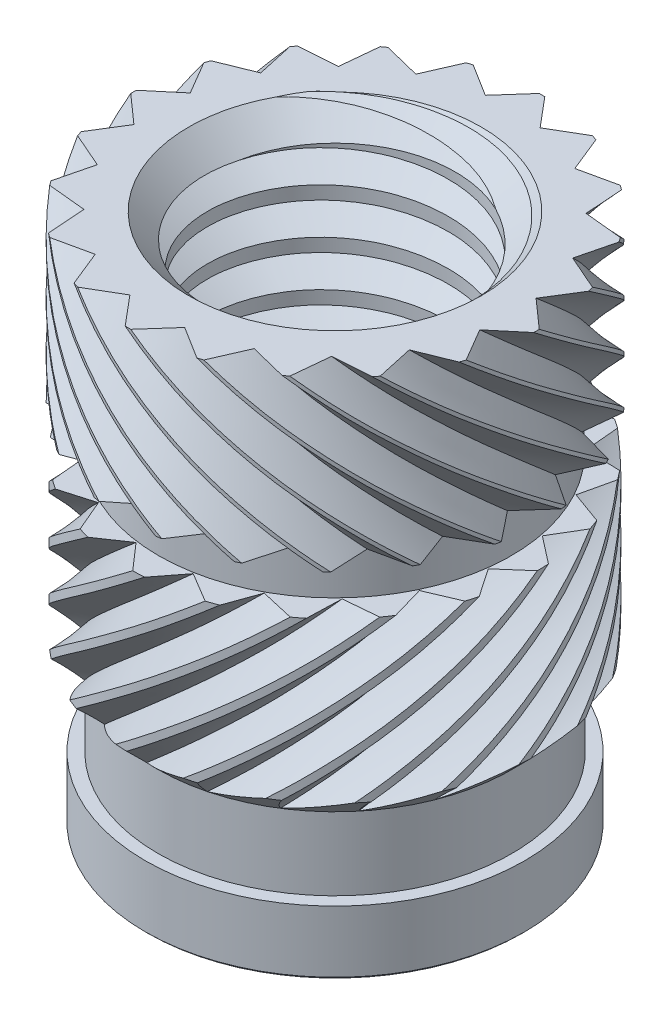
from build123d import *

# Parameters (mm, degrees)
CHAMFER2_SIZE     = 0.4
CUT_SWEEP2_PITCH  = 0.7
CUT_SWEEP7_PITCH  = 15
CIRPATTERN1_COUNT = 20
CUT_SWEEP9_PITCH  = 15
CIRPATTERN4_COUNT = 20


with BuildPart() as part:
    # Sketch1 → Revolve1 (revolve)
    with BuildSketch(Plane.XY, mode=Mode.PRIVATE) as revolve1_sk:
        Polygon((3.15, 0), (1.8553, 0), (1.8553, -8.2), (2.88478468, -8.2), (2.923211, -8.16157368), (2.923211, -7.21157368), (2.729, -7.21157368), (2.729, -6.08947368), (3.119, -5.69947368), (3.119, -3.23947368), (2.719, -3.23947368), (2.719, -2.58947368), (3.15, -2.58947368), align=None)
    revolve(revolve1_sk.sketch.rotate(Axis((0, 2.596055606, 0), (0, -1, 0)), 90), axis=Axis((0, 2.596055606, 0), (0, -1, 0)))

    # Chamfer2
    chamfer2_edges = [part.edges().sort_by_distance(p)[0] for p in [
        (0, 0, -1.8553),
    ]]
    chamfer(chamfer2_edges, length=CHAMFER2_SIZE)

    # Cut-Sweep2: the profile of Sketch3 profile screwed along a right-hand helix of 13 turns, 6 arcs to a turn; built about Z, then put on its axis
    cut_sweep2_z = Axis((0, 0, 0), (0, 0, 1))
    cut_sweep2_corners = [(1.855, 0, 0.000173205), (2.2847, 0, -0.247914206), (1.855, 0, -0.496001616)]
    with BuildLine(mode=Mode.PRIVATE) as cut_sweep2_profile:
        Line(cut_sweep2_corners[0], cut_sweep2_corners[1])
        Line(cut_sweep2_corners[1], cut_sweep2_corners[2])
        Line(cut_sweep2_corners[2], cut_sweep2_corners[0])
    cut_sweep2_cap = Face(cut_sweep2_profile.wire())
    cut_sweep2_turn_angles = [0, 30, 60, 90, 120, 150, 180, 210, 240, 270, 300, 330, 360]
    cut_sweep2_turn_weights = [1, 0.8660254037844387, 1, 0.8660254037844387, 1, 0.8660254037844387, 1, 0.8660254037844387, 1, 0.8660254037844387, 1, 0.8660254037844387, 1]
    cut_sweep2_turn_rails = [Edge.make_bspline([Vector(p[0], p[1], 0).rotate(cut_sweep2_z, cut_sweep2_turn_angles[k]) / cut_sweep2_turn_weights[k] + Vector(0, 0, p[2] + CUT_SWEEP2_PITCH * cut_sweep2_turn_angles[k] / 360) for k in range(13)], [0, 0, 0, 1, 1, 2, 2, 3, 3, 4, 4, 5, 5, 6, 6, 6], 2, cut_sweep2_turn_weights) for p in cut_sweep2_corners]
    cut_sweep2_turn_sides = [Face.make_surface_from_curves(cut_sweep2_turn_rails[p[0]], cut_sweep2_turn_rails[p[1]]) for p in [(0, 1), (1, 2), (2, 0)]]
    cut_sweep2 = Plane(origin=(0, 0, 0), x_dir=(0, 0, 1), z_dir=(0, -1, 0)) * Solid(Shell([*[p.moved(Location((0, 0, CUT_SWEEP2_PITCH * i))) for i in range(13) for p in cut_sweep2_turn_sides], cut_sweep2_cap, cut_sweep2_cap.rotate(cut_sweep2_z, 4680).moved(Location((0, 0, CUT_SWEEP2_PITCH * 4680 / 360)))]))
    add(cut_sweep2, mode=Mode.SUBTRACT)

    # Cut-Sweep7: the profile of Sketch5 screwed along a left-hand helix of 0.18 turns, 18 arcs to a turn; built about Z, then put on its axis
    cut_sweep7_z = Axis((0, 0, 0), (0, 0, 1))
    cut_sweep7_corners = [(3.15, 0, 0), (2.709611825, -0.391098779, 0), (3.021428571, -0.890768987, 0), (3.292552995, -0.47523909, 0)]
    with BuildLine(mode=Mode.PRIVATE) as cut_sweep7_profile:
        Line(cut_sweep7_corners[0], cut_sweep7_corners[1])
        Line(cut_sweep7_corners[1], cut_sweep7_corners[2])
        ThreePointArc((3.021428571, -0.890768987, 0), (3.202880723, -0.712946248, 0), (3.292552995, -0.47523909, 0))
        ThreePointArc((3.292552995, -0.47523909, 0), (3.273760551, -0.221876397, 0), (3.15, 0, 0))
    cut_sweep7_cap = Face(cut_sweep7_profile.wire())
    cut_sweep7_arcs = [((3.021428571, -0.890768987, 0), (3.253477829, -0.745959784, 0), (3.292552995, -0.47523909, 0), (1, 0.9069677000385052, 1)), ((3.292552995, -0.47523909, 0), (3.331628161, -0.204518395, 0), (3.15, 0, 0), (1, 0.9069677000385052, 1))]  # start, shoulder, end, weights
    cut_sweep7_turn_angles = [0, -10, -20, -30, -40, -50, -60, -62.4, -64.8]
    cut_sweep7_turn_weights = [1, 0.984807753012208, 1, 0.984807753012208, 1, 0.984807753012208, 1, 0.9991228300988583, 1]
    cut_sweep7_turn_rails = [Edge.make_bspline([Vector(p[0], p[1], 0).rotate(cut_sweep7_z, cut_sweep7_turn_angles[k]) / cut_sweep7_turn_weights[k] + Vector(0, 0, p[2] + -CUT_SWEEP7_PITCH * cut_sweep7_turn_angles[k] / 360) for k in range(9)], [0, 0, 0, 1, 1, 2, 2, 3, 3, 4, 4, 4], 2, cut_sweep7_turn_weights) for p in cut_sweep7_corners]
    cut_sweep7_turn_sides = [*[Face.make_surface_from_curves(cut_sweep7_turn_rails[p[0]], cut_sweep7_turn_rails[p[1]]) for p in [(0, 1), (1, 2)]], *[Face.make_bezier_surface([[Vector(p[j][0], p[j][1], 0).rotate(cut_sweep7_z, cut_sweep7_turn_angles[2 * i + k]) / cut_sweep7_turn_weights[2 * i + k] + Vector(0, 0, p[j][2] + -CUT_SWEEP7_PITCH * cut_sweep7_turn_angles[2 * i + k] / 360) for k in range(3)] for j in range(3)], [[p[3][j] * cut_sweep7_turn_weights[2 * i + k] for k in range(3)] for j in range(3)]) for p in cut_sweep7_arcs for i in range(4)]]
    cut_sweep7 = Plane(origin=(0, 0, 0), x_dir=(0, 0, 1), z_dir=(0, -1, 0)) * Solid(Shell([*cut_sweep7_turn_sides, cut_sweep7_cap, cut_sweep7_cap.rotate(cut_sweep7_z, -64.8).moved(Location((0, 0, -CUT_SWEEP7_PITCH * -64.8 / 360)))]))
    add(cut_sweep7, mode=Mode.SUBTRACT)

    # CirPattern1: Cut-Sweep7 ×20 about axis
    cirpattern1_axis = Axis((0, 1.831049977, 0), (0, -1, 0))
    for i in range(1, CIRPATTERN1_COUNT):
        add(cut_sweep7.rotate(cirpattern1_axis, i * 360 / CIRPATTERN1_COUNT), mode=Mode.SUBTRACT)

    # Cut-Sweep9: the profile of Sketch8 screwed along a right-hand helix of 0.195 turns, 18 arcs to a turn; built about Z, then put on its axis
    cut_sweep9_z = Axis((0, 0, 0), (0, 0, 1))
    cut_sweep9_corners = [(2.716374539, 0.351326576, 0), (3.119, 0, 0), (3.459874357, 0.237912417, 0), (3.406554635, 0.650167984, 0), (3.016367877, 0.793527461, 0)]
    with BuildLine(mode=Mode.PRIVATE) as cut_sweep9_profile:
        Line(cut_sweep9_corners[0], cut_sweep9_corners[1])
        Line(cut_sweep9_corners[4], cut_sweep9_corners[0])
        ThreePointArc((3.119, 0, 0), (3.322681969, 0.071323989, 0), (3.459874357, 0.237912417, 0))
        ThreePointArc((3.459874357, 0.237912417, 0), (3.490821198, 0.451490854, 0), (3.406554635, 0.650167984, 0))
        ThreePointArc((3.406554635, 0.650167984, 0), (3.231493652, 0.77637063, 0), (3.016367877, 0.793527461, 0))
    cut_sweep9_cap = Face(cut_sweep9_profile.wire())
    cut_sweep9_arcs = [((3.119, 0, 0), (3.361559821, 0.015620873, 0), (3.459874357, 0.237912417, 0), (1, 0.8551086961381499, 1)), ((3.459874357, 0.237912417, 0), (3.558188894, 0.460203961, 0), (3.406554635, 0.650167984, 0), (1, 0.8551086961381499, 1)), ((3.406554635, 0.650167984, 0), (3.254920376, 0.840132007, 0), (3.016367877, 0.793527461, 0), (1, 0.8551086961381499, 1))]  # start, shoulder, end, weights
    cut_sweep9_turn_angles = [0, 10, 20, 30, 40, 50, 60, 65.1, 70.2]
    cut_sweep9_turn_weights = [1, 0.984807753012208, 1, 0.984807753012208, 1, 0.984807753012208, 1, 0.9960410654107694, 1]
    cut_sweep9_turn_rails = [Edge.make_bspline([Vector(p[0], p[1], 0).rotate(cut_sweep9_z, cut_sweep9_turn_angles[k]) / cut_sweep9_turn_weights[k] + Vector(0, 0, p[2] + CUT_SWEEP9_PITCH * cut_sweep9_turn_angles[k] / 360) for k in range(9)], [0, 0, 0, 1, 1, 2, 2, 3, 3, 4, 4, 4], 2, cut_sweep9_turn_weights) for p in cut_sweep9_corners]
    cut_sweep9_turn_sides = [*[Face.make_surface_from_curves(cut_sweep9_turn_rails[p[0]], cut_sweep9_turn_rails[p[1]]) for p in [(0, 1), (4, 0)]], *[Face.make_bezier_surface([[Vector(p[j][0], p[j][1], 0).rotate(cut_sweep9_z, cut_sweep9_turn_angles[2 * i + k]) / cut_sweep9_turn_weights[2 * i + k] + Vector(0, 0, p[j][2] + CUT_SWEEP9_PITCH * cut_sweep9_turn_angles[2 * i + k] / 360) for k in range(3)] for j in range(3)], [[p[3][j] * cut_sweep9_turn_weights[2 * i + k] for k in range(3)] for j in range(3)]) for p in cut_sweep9_arcs for i in range(4)]]
    cut_sweep9 = Plane(origin=(0, -3.23947368, 0), x_dir=(0, 0, 1), z_dir=(0, -1, 0)) * Solid(Shell([*cut_sweep9_turn_sides, cut_sweep9_cap, cut_sweep9_cap.rotate(cut_sweep9_z, 70.2).moved(Location((0, 0, CUT_SWEEP9_PITCH * 70.2 / 360)))]))
    add(cut_sweep9, mode=Mode.SUBTRACT)

    # CirPattern4: Cut-Sweep9 ×20 about axis
    cirpattern4_axis = Axis((0, 1.831049977, 0), (0, -1, 0))
    for i in range(1, CIRPATTERN4_COUNT):
        add(cut_sweep9.rotate(cirpattern4_axis, i * 360 / CIRPATTERN4_COUNT), mode=Mode.SUBTRACT)


solid = part.part
